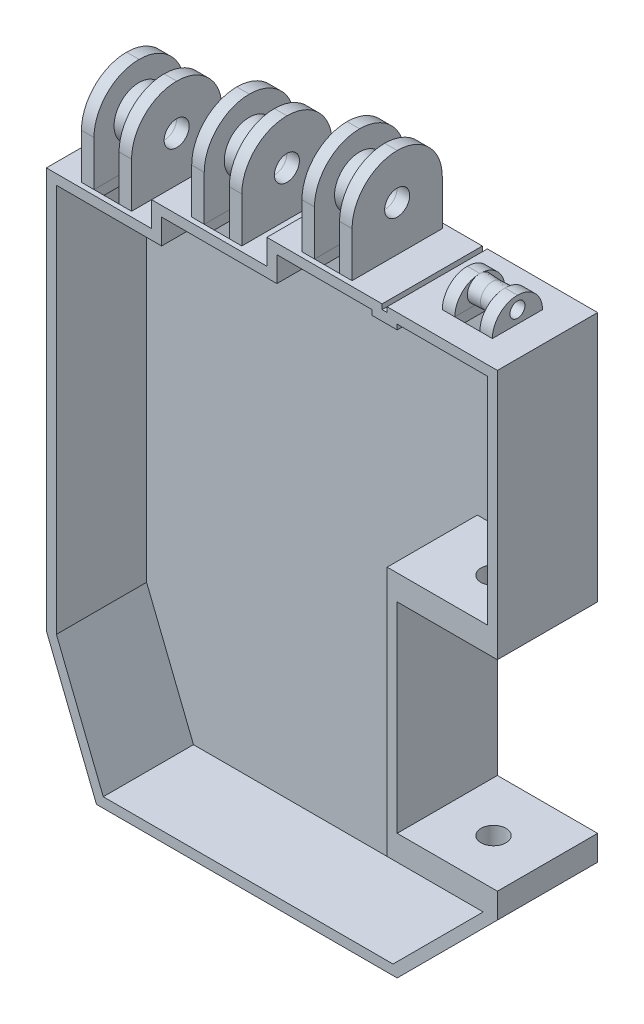
from build123d import *

# Parameters (mm, degrees)
BOSS_EXTRUDE1_DEPTH       = 20
SKETCH2_W                 = 20
SKETCH2_H                 = 40
CUT_EXTRUDE1_DEPTH        = 142.509716981
SHELL1_T                  = -2
SHELL1_THICKNESS_2_FACE_W = 20
SHELL1_THICKNESS_2_FACE_H = 18
SHELL1_THICKNESS_2_DEPTH  = 3
SHELL1_THICKNESS_3_FACE_W = 18
SHELL1_THICKNESS_3_FACE_H = 20
SHELL1_THICKNESS_3_DEPTH  = 3
SKETCH3_W                 = 2.5
SKETCH3_H                 = 10
BOSS_EXTRUDE2_DEPTH       = 5
BOSS_EXTRUDE2_2_DEPTH     = 5
FILLET2_R                 = 5
FILLET3_R                 = 5
CUT_EXTRUDE3_START        = -10
SKETCH6_R                 = 1.5
CUT_EXTRUDE3_DEPTH        = 10
SKETCH7_W                 = 2.5
SKETCH7_H                 = 18
BOSS_EXTRUDE4_DEPTH       = 18
BOSS_EXTRUDE4_2_DEPTH     = 18
FILLET4_R                 = 9
FILLET5_R                 = 9
SKETCH8_R                 = 5
BOSS_EXTRUDE5_DEPTH       = 2.5
BOSS_EXTRUDE5_TAPER       = 10
CUT_EXTRUDE4_START        = -10
SKETCH9_R                 = 2.5
CUT_EXTRUDE4_DEPTH        = 10
SKETCH10_W                = 2.5
SKETCH10_H                = 18
BOSS_EXTRUDE6_DEPTH       = 18
BOSS_EXTRUDE6_2_DEPTH     = 18
FILLET6_R                 = 9
FILLET7_R                 = 9
SKETCH11_R                = 5
BOSS_EXTRUDE7_DEPTH       = 2.5
BOSS_EXTRUDE7_TAPER       = 10
CUT_EXTRUDE5_START        = -10
SKETCH12_R                = 2.5
CUT_EXTRUDE5_DEPTH        = 32
SKETCH13_W                = 2.5
SKETCH13_H                = 18
BOSS_EXTRUDE8_DEPTH       = 18
BOSS_EXTRUDE8_2_DEPTH     = 18
FILLET8_R                 = 9
FILLET9_R                 = 9
SKETCH14_R                = 5
BOSS_EXTRUDE9_DEPTH       = 2.5
BOSS_EXTRUDE9_TAPER       = 10
CUT_EXTRUDE6_START        = -10
SKETCH15_R                = 2.5
CUT_EXTRUDE6_DEPTH        = 54
SKETCH16_W                = 5
SKETCH16_H                = 10
SKETCH16_H_2              = 18
CUT_EXTRUDE7_DEPTH        = 2
CUT_EXTRUDE8_DEPTH        = 2
SKETCH18_W                = 5
SKETCH18_H                = 18
CUT_EXTRUDE9_DEPTH        = 2
CUT_EXTRUDE10_REACH       = 110.167
SKETCH19_R                = 2.5
SKETCH21_R                = 2.5
SKETCH21_R_2              = 1.5
BOSS_EXTRUDE10_DEPTH      = 2.5
BOSS_EXTRUDE10_DRAFT      = 3
MIRROR7_COPY_1_SKETCH_R   = 2.5
MIRROR7_COPY_1_SKETCH_R_2 = 1.5
MIRROR7_COPY_1_DEPTH      = 2.5
MIRROR7_COPY_1_DRAFT      = 3


with BuildPart() as part:
    # Sketch1 → Boss-Extrude1 (new body)
    with BuildSketch(Plane.XY):
        Polygon((58, 114), (58, 115), (80, 115), (80, 20), (60, 0), (0, 0), (-10, 25), (-10, 105), (11, 105), (11, 110), (12, 110), (34, 110), (34, 115), (35, 115), (57, 115), (57, 114), align=None)
    extrude(amount=BOSS_EXTRUDE1_DEPTH)

    # Sketch2 → Cut-Extrude1 (cut, through all)
    with BuildSketch(Plane.XY.offset(20)):
        with Locations((70, 45)):
            Rectangle(SKETCH2_W, SKETCH2_H)
    extrude(amount=-CUT_EXTRUDE1_DEPTH, mode=Mode.SUBTRACT)

    # Shell1
    shell1_openings = [part.faces().sort_by_distance(p)[0] for p in [
        (32.550473836, 58.500730419, 20),
    ]]
    offset(amount=SHELL1_T, openings=shell1_openings, kind=Kind.INTERSECTION)

    # Shell1 thickness 2 face (on inner face of the shell) → Shell1 thickness 2 (add)
    with BuildSketch(Plane(origin=(68, 23, 11), x_dir=(1, 0, 0), z_dir=(0, 1, 0))):
        Rectangle(SHELL1_THICKNESS_2_FACE_W, SHELL1_THICKNESS_2_FACE_H)
    extrude(amount=-SHELL1_THICKNESS_2_DEPTH)

    # Shell1 thickness 3 face (on inner face of the shell) → Shell1 thickness 3 (add)
    with BuildSketch(Plane(origin=(68, 67, 11), x_dir=(0, 0, -1), z_dir=(0, -1, 0))):
        Rectangle(SHELL1_THICKNESS_3_FACE_W, SHELL1_THICKNESS_3_FACE_H)
    extrude(amount=-SHELL1_THICKNESS_3_DEPTH)

    # Sketch16 → Cut-Extrude7 (cut)
    with BuildSketch(Plane(origin=(0, 115, 0), x_dir=(1, 0, 0), z_dir=(0, 1, 0))):
        with Locations((69, -10)):
            Rectangle(SKETCH16_W, SKETCH16_H)
        with Locations((45, -10)):
            Rectangle(SKETCH16_W, SKETCH16_H_2)
    extrude(amount=-CUT_EXTRUDE7_DEPTH, mode=Mode.SUBTRACT)

    # Sketch17 → Cut-Extrude8 (cut)
    with BuildSketch(Plane(origin=(0, 110, 0), x_dir=(1, 0, 0), z_dir=(0, 1, 0))):
        Polygon((20.5, -19), (25.5, -19), (25.5, -0.86865848), (20.5, -1), align=None)
    extrude(amount=-CUT_EXTRUDE8_DEPTH, mode=Mode.SUBTRACT)

    # Sketch18 → Cut-Extrude9 (cut)
    with BuildSketch(Plane(origin=(0, 105, 0), x_dir=(1, 0, 0), z_dir=(0, 1, 0))):
        with Locations((1, -10)):
            Rectangle(SKETCH18_W, SKETCH18_H)
    extrude(amount=-CUT_EXTRUDE9_DEPTH, mode=Mode.SUBTRACT)

    # Cut-Extrude10: up to this face of the body (flat: up to its plane)
    cut_extrude10_end = Plane(part.part.faces().sort_by_distance((67.585786438, 20, 11))[0])
    # Sketch19 → Cut-Extrude10 (cut, up to the picked face)
    with BuildSketch(Plane(origin=(0, 70, 0), x_dir=(1, 0, 0), z_dir=(0, 1, 0)), mode=Mode.PRIVATE) as cut_extrude10_sk1:
        with Locations(Location((70, -10.774964387, 0), (0, 0, 270))):
            Circle(SKETCH19_R)
    cut_extrude10_tool1 = split(extrude(cut_extrude10_sk1.sketch, amount=-CUT_EXTRUDE10_REACH, mode=Mode.PRIVATE), bisect_by=cut_extrude10_end, keep=Keep.BOTH, mode=Mode.PRIVATE)
    add(cut_extrude10_tool1.solids().sort_by(Axis((70, 70, 10.774964), (0, -1, 0)))[0], mode=Mode.SUBTRACT)


with BuildPart() as body_2:
    # Sketch3 → Boss-Extrude2 (new body)
    with BuildSketch(Plane(origin=(0, 115, 0), x_dir=(1, 0, 0), z_dir=(0, 1, 0))):
        with Locations((65.25, -10)):
            Rectangle(SKETCH3_W, SKETCH3_H)
    extrude(amount=BOSS_EXTRUDE2_DEPTH)

    # Fillet2
    fillet2_edges = [body_2.edges().sort_by_distance(p)[0] for p in [
        (65.25, 120, 5),
        (65.25, 120, 15),
    ]]
    fillet(fillet2_edges, radius=FILLET2_R - 0.0001)  # a hair under: the kernel refuses the full size


with BuildPart() as body_3:
    # Sketch3 → Boss-Extrude2 2 (new body)
    with BuildSketch(Plane(origin=(0, 115, 0), x_dir=(1, 0, 0), z_dir=(0, 1, 0))):
        with Locations((72.75, -10)):
            Rectangle(SKETCH3_W, SKETCH3_H)
    extrude(amount=BOSS_EXTRUDE2_2_DEPTH)

    # Fillet3
    fillet3_edges = [body_3.edges().sort_by_distance(p)[0] for p in [
        (72.75, 120, 5),
        (72.75, 120, 15),
    ]]
    fillet(fillet3_edges, radius=FILLET3_R - 0.0001)  # a hair under: the kernel refuses the full size


with BuildPart() as cut_extrude3_tool:
    # Sketch6 → Cut-Extrude3 (new body)
    with BuildSketch(Plane(origin=(74, 0, 0), x_dir=(0, 0, -1), z_dir=(1, 0, 0)).offset(CUT_EXTRUDE3_START)):
        with Locations((-10, 117.5)):
            Circle(SKETCH6_R)
    extrude(amount=CUT_EXTRUDE3_DEPTH)


with BuildPart() as body_2_1:
    add(body_2.part)

    # Cut-Extrude3: cut by cut_extrude3_tool
    add(cut_extrude3_tool.part, mode=Mode.SUBTRACT)


with BuildPart() as body_3_1:
    add(body_3.part)

    # Cut-Extrude3: cut by cut_extrude3_tool
    add(cut_extrude3_tool.part, mode=Mode.SUBTRACT)


with BuildPart() as body_4:
    # Sketch7 → Boss-Extrude4 (new body)
    with BuildSketch(Plane(origin=(0, 115, 0), x_dir=(1, 0, 0), z_dir=(0, 1, 0))):
        with Locations((41.25, -10)):
            Rectangle(SKETCH7_W, SKETCH7_H)
    extrude(amount=BOSS_EXTRUDE4_DEPTH)

    # Fillet4
    fillet4_edges = [body_4.edges().sort_by_distance(p)[0] for p in [
        (41.25, 133, 1),
        (41.25, 133, 19),
    ]]
    fillet(fillet4_edges, radius=FILLET4_R - 0.0001)  # a hair under: the kernel refuses the full size

    # Sketch8 → Boss-Extrude5 (add)
    with BuildSketch(Plane(origin=(42.5, 0, 0), x_dir=(0, 0, -1), z_dir=(1, 0, 0))):
        with Locations((-10, 124)):
            Circle(SKETCH8_R)
    boss_extrude5 = extrude(amount=BOSS_EXTRUDE5_DEPTH, taper=BOSS_EXTRUDE5_TAPER)

    # Mirror2: Boss-Extrude5 across plane
    add(boss_extrude5.mirror(Plane(origin=(45, 124, 10), x_dir=(0, 0, 1), z_dir=(1, 0, 0))))


with BuildPart() as body_5:
    # Sketch7 → Boss-Extrude4 2 (new body)
    with BuildSketch(Plane(origin=(0, 115, 0), x_dir=(1, 0, 0), z_dir=(0, 1, 0))):
        with Locations((48.75, -10)):
            Rectangle(SKETCH7_W, SKETCH7_H)
    extrude(amount=BOSS_EXTRUDE4_2_DEPTH)

    # Fillet5
    fillet5_edges = [body_5.edges().sort_by_distance(p)[0] for p in [
        (48.75, 133, 19),
        (48.75, 133, 1),
    ]]
    fillet(fillet5_edges, radius=FILLET5_R - 0.0001)  # a hair under: the kernel refuses the full size


with BuildPart() as cut_extrude4_tool:
    # Sketch9 → Cut-Extrude4 (new body)
    with BuildSketch(Plane(origin=(50, 0, 0), x_dir=(0, 0, -1), z_dir=(1, 0, 0)).offset(CUT_EXTRUDE4_START)):
        with Locations(Location((-10, 124, 0), (0, 0, 90))):
            Circle(SKETCH9_R)
    extrude(amount=CUT_EXTRUDE4_DEPTH)


with BuildPart() as body_4_1:
    add(body_4.part)

    # Cut-Extrude4: cut by cut_extrude4_tool
    add(cut_extrude4_tool.part, mode=Mode.SUBTRACT)


with BuildPart() as body_5_1:
    add(body_5.part)

    # Cut-Extrude4: cut by cut_extrude4_tool
    add(cut_extrude4_tool.part, mode=Mode.SUBTRACT)


with BuildPart() as body_6:
    # Sketch10 → Boss-Extrude6 (new body)
    with BuildSketch(Plane(origin=(0, 110, 0), x_dir=(1, 0, 0), z_dir=(0, 1, 0))):
        with Locations((19.25, -10)):
            Rectangle(SKETCH10_W, SKETCH10_H)
    extrude(amount=BOSS_EXTRUDE6_DEPTH)

    # Fillet6
    fillet6_edges = [body_6.edges().sort_by_distance(p)[0] for p in [
        (19.25, 128, 19),
        (19.25, 128, 1),
    ]]
    fillet(fillet6_edges, radius=FILLET6_R - 0.0001)  # a hair under: the kernel refuses the full size

    # Sketch11 → Boss-Extrude7 (add)
    with BuildSketch(Plane(origin=(20.5, 0, 0), x_dir=(0, 0, -1), z_dir=(1, 0, 0))):
        with Locations((-10, 119)):
            Circle(SKETCH11_R)
    boss_extrude7 = extrude(amount=BOSS_EXTRUDE7_DEPTH, taper=BOSS_EXTRUDE7_TAPER)

    # Mirror3: Boss-Extrude7 across plane
    add(boss_extrude7.mirror(Plane(origin=(23, 119, 10), x_dir=(0, 0, 1), z_dir=(1, 0, 0))))


with BuildPart() as body_7:
    # Sketch10 → Boss-Extrude6 2 (new body)
    with BuildSketch(Plane(origin=(0, 110, 0), x_dir=(1, 0, 0), z_dir=(0, 1, 0))):
        with Locations((26.75, -10)):
            Rectangle(SKETCH10_W, SKETCH10_H)
    extrude(amount=BOSS_EXTRUDE6_2_DEPTH)

    # Fillet7
    fillet7_edges = [body_7.edges().sort_by_distance(p)[0] for p in [
        (26.75, 128, 19),
        (26.75, 128, 1),
    ]]
    fillet(fillet7_edges, radius=FILLET7_R - 0.0001)  # a hair under: the kernel refuses the full size


with BuildPart() as cut_extrude5_tool:
    # Sketch12 → Cut-Extrude5 (new body)
    with BuildSketch(Plane(origin=(28, 0, 0), x_dir=(0, 0, -1), z_dir=(1, 0, 0)).offset(CUT_EXTRUDE5_START)):
        with Locations((-10, 119)):
            Circle(SKETCH12_R)
    extrude(amount=CUT_EXTRUDE5_DEPTH)


with BuildPart() as body_7_1:
    add(body_7.part)

    # Cut-Extrude5: cut by cut_extrude5_tool
    add(cut_extrude5_tool.part, mode=Mode.SUBTRACT)


with BuildPart() as body_6_1:
    add(body_6.part)

    # Cut-Extrude5: cut by cut_extrude5_tool
    add(cut_extrude5_tool.part, mode=Mode.SUBTRACT)


with BuildPart() as body_8:
    # Sketch13 → Boss-Extrude8 (new body)
    with BuildSketch(Plane(origin=(0, 105, 0), x_dir=(1, 0, 0), z_dir=(0, 1, 0))):
        with Locations((-2.75, -10)):
            Rectangle(SKETCH13_W, SKETCH13_H)
    extrude(amount=BOSS_EXTRUDE8_DEPTH)

    # Fillet8
    fillet8_edges = [body_8.edges().sort_by_distance(p)[0] for p in [
        (-2.75, 123, 19),
        (-2.75, 123, 1),
    ]]
    fillet(fillet8_edges, radius=FILLET8_R - 0.0001)  # a hair under: the kernel refuses the full size

    # Sketch14 → Boss-Extrude9 (add)
    with BuildSketch(Plane(origin=(-1.5, 0, 0), x_dir=(0, 0, -1), z_dir=(1, 0, 0))):
        with Locations((-10, 114)):
            Circle(SKETCH14_R)
    boss_extrude9 = extrude(amount=BOSS_EXTRUDE9_DEPTH, taper=BOSS_EXTRUDE9_TAPER)

    # Mirror4: Boss-Extrude9 across plane
    add(boss_extrude9.mirror(Plane(origin=(1, 114, 10), x_dir=(0, 0, 1), z_dir=(1, 0, 0))))


with BuildPart() as body_9:
    # Sketch13 → Boss-Extrude8 2 (new body)
    with BuildSketch(Plane(origin=(0, 105, 0), x_dir=(1, 0, 0), z_dir=(0, 1, 0))):
        with Locations((4.75, -10)):
            Rectangle(SKETCH13_W, SKETCH13_H)
    extrude(amount=BOSS_EXTRUDE8_2_DEPTH)

    # Fillet9
    fillet9_edges = [body_9.edges().sort_by_distance(p)[0] for p in [
        (4.75, 123, 1),
        (4.75, 123, 19),
    ]]
    fillet(fillet9_edges, radius=FILLET9_R - 0.0001)  # a hair under: the kernel refuses the full size


with BuildPart() as cut_extrude6_tool:
    # Sketch15 → Cut-Extrude6 (new body)
    with BuildSketch(Plane(origin=(6, 0, 0), x_dir=(0, 0, -1), z_dir=(1, 0, 0)).offset(CUT_EXTRUDE6_START)):
        with Locations((-10, 114)):
            Circle(SKETCH15_R)
    extrude(amount=CUT_EXTRUDE6_DEPTH)


with BuildPart() as body_9_1:
    add(body_9.part)

    # Cut-Extrude6: cut by cut_extrude6_tool
    add(cut_extrude6_tool.part, mode=Mode.SUBTRACT)


with BuildPart() as body_8_1:
    add(body_8.part)

    # Cut-Extrude6: cut by cut_extrude6_tool
    add(cut_extrude6_tool.part, mode=Mode.SUBTRACT)


with BuildPart() as boss_extrude10_tool:
    # Sketch21 → Boss-Extrude10 (with draft: the straight prism first)
    with BuildSketch(Plane(origin=(66.5, 0, 0), x_dir=(0, 0, -1), z_dir=(1, 0, 0))):
        with Locations((-10, 117.5)):
            Circle(SKETCH21_R)
        with Locations((-10, 117.5)):
            Circle(SKETCH21_R_2, mode=Mode.SUBTRACT)
    extrude(amount=BOSS_EXTRUDE10_DEPTH)
    # Boss-Extrude10: the draft: its side faces are tilted about the plane it starts from
    boss_extrude10_sides = [boss_extrude10_tool.faces().sort_by_distance(p)[0] for p in [
        (67.75, 117.5, 12.5),
        (67.75, 117.5, 11.5),
    ]]
    draft(boss_extrude10_sides, Plane(origin=(66.5, 0, 0), x_dir=(0, 0, -1), z_dir=(1, 0, 0)), BOSS_EXTRUDE10_DRAFT)


with BuildPart() as body_2_2:
    add(body_2_1.part)

    # Boss-Extrude10: add boss_extrude10_tool
    add(boss_extrude10_tool.part)


with BuildPart() as mirror7_copy_1_tool:
    # Mirror7 copy 1 sketch → Mirror7 copy 1 (with draft: the straight prism first)
    with BuildSketch(Plane(origin=(71.5, 0, 0), x_dir=(0, 0, -1), z_dir=(-1, 0, 0))):
        with Locations((-10, -117.5)):
            Circle(MIRROR7_COPY_1_SKETCH_R)
        with Locations((-10, -117.5)):
            Circle(MIRROR7_COPY_1_SKETCH_R_2, mode=Mode.SUBTRACT)
    extrude(amount=MIRROR7_COPY_1_DEPTH)
    # Mirror7 copy 1: the draft: its side faces are tilted about the plane it starts from
    mirror7_copy_1_sides = [mirror7_copy_1_tool.faces().sort_by_distance(p)[0] for p in [
        (70.25, 117.5, 12.5),
        (70.25, 117.5, 11.5),
    ]]
    draft(mirror7_copy_1_sides, Plane(origin=(71.5, 0, 0), x_dir=(0, 0, -1), z_dir=(-1, 0, 0)), MIRROR7_COPY_1_DRAFT)


with BuildPart() as body_2_3:
    add(body_2_2.part)

    # Mirror7 copy 1: add mirror7_copy_1_tool
    add(mirror7_copy_1_tool.part)


solid = Compound([part.part, body_3_1.part, body_4_1.part, body_5_1.part, body_7_1.part, body_6_1.part, body_9_1.part, body_8_1.part, body_2_3.part])
